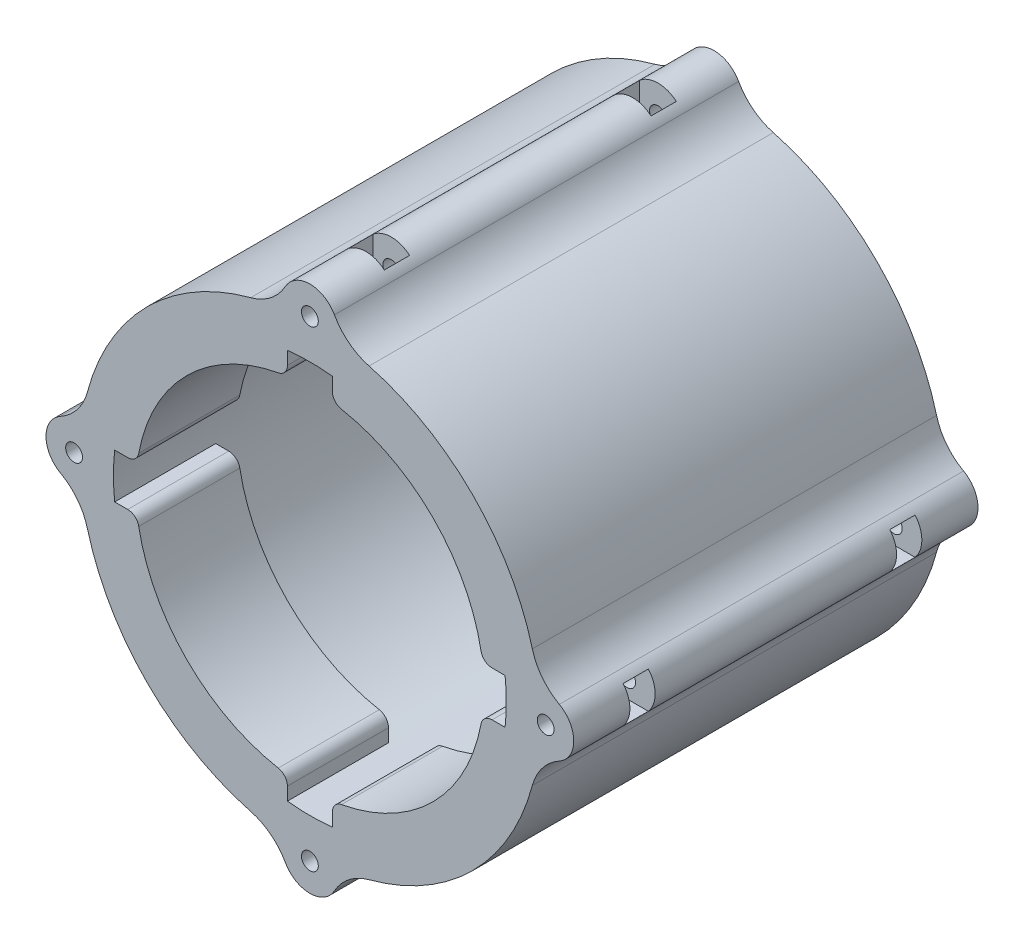
from build123d import *

# Parameters (mm, degrees)
IZIM1_R                     = 35
IZIM1_R_2                   = 1.5
Y_KSEKLIK_EKSTR_ZYON1_DEPTH = 72
Y_KSEKLIK_EKSTR_ZYON2_START = -18
Y_KSEKLIK_EKSTR_ZYON2_DEPTH = 18
KES_EKSTR_ZYON1_DEPTH       = 4.5
DAIRESEL_KAPLAMA1_COUNT     = 4
AYNALAMA1_COPY_1_DEPTH      = 4.5
AYNALAMA1_COPY_2_DEPTH      = 4.5
AYNALAMA1_COPY_3_DEPTH      = 4.5
AYNALAMA1_COPY_4_DEPTH      = 4.5


with BuildPart() as part:
    # Çizim1 → Yükseklik-Ekstrüzyon1 (new body)
    with BuildSketch(Plane.XY):
        with BuildLine():
            ThreePointArc((-39.621848739, -10.540830255), (-28.991378029, -28.991378029), (-10.540830255, -39.621848739))
            ThreePointArc((-10.540830255, -39.621848739), (-6.966269622, -41.396931543), (-4.370588155, -44.428571429))
            ThreePointArc((-4.370588155, -44.428571429), (0, -47), (4.370588155, -44.428571429))
            ThreePointArc((4.370588155, -44.428571429), (6.966269622, -41.396931543), (10.540830255, -39.621848739))
            ThreePointArc((10.540830255, -39.621848739), (28.991378029, -28.991378029), (39.621848739, -10.540830255))
            ThreePointArc((39.621848739, -10.540830255), (41.396931543, -6.966269622), (44.428571429, -4.370588155))
            ThreePointArc((44.428571429, -4.370588155), (47, 0), (44.428571429, 4.370588155))
            ThreePointArc((44.428571429, 4.370588155), (41.396931543, 6.966269622), (39.621848739, 10.540830255))
            ThreePointArc((39.621848739, 10.540830255), (28.991378029, 28.991378029), (10.540830255, 39.621848739))
            ThreePointArc((10.540830255, 39.621848739), (6.966269622, 41.396931543), (4.370588155, 44.428571429))
            ThreePointArc((4.370588155, 44.428571429), (0, 47), (-4.370588155, 44.428571429))
            ThreePointArc((-4.370588155, 44.428571429), (-6.966269622, 41.396931543), (-10.540830255, 39.621848739))
            ThreePointArc((-10.540830255, 39.621848739), (-28.991378029, 28.991378029), (-39.621848739, 10.540830255))
            ThreePointArc((-39.621848739, 10.540830255), (-41.396931543, 6.966269622), (-44.428571429, 4.370588155))
            ThreePointArc((-44.428571429, 4.370588155), (-47, 0), (-44.428571429, -4.370588155))
            ThreePointArc((-44.428571429, -4.370588155), (-41.396931543, -6.966269622), (-39.621848739, -10.540830255))
        make_face()
        Circle(IZIM1_R, mode=Mode.SUBTRACT)
        with Locations((-42, 0)):
            Circle(IZIM1_R_2, mode=Mode.SUBTRACT)
        with Locations((0, 42)):
            Circle(IZIM1_R_2, mode=Mode.SUBTRACT)
        with Locations((42, 0)):
            Circle(IZIM1_R_2, mode=Mode.SUBTRACT)
        with Locations((0, -42)):
            Circle(IZIM1_R_2, mode=Mode.SUBTRACT)
    extrude(amount=Y_KSEKLIK_EKSTR_ZYON1_DEPTH)

    # Çizim2 → Yükseklik-Ekstrüzyon2 (add)
    with BuildSketch(Plane.XY.offset(72).offset(Y_KSEKLIK_EKSTR_ZYON2_START)):
        with BuildLine():
            Line((-4, 34.770677301), (-4, 32.449961479))
            ThreePointArc((-4, 32.449961479), (-4.46258777, 31.170757181), (-5.636363636, 30.483297147))
            ThreePointArc((-5.636363636, 30.483297147), (-21.920310217, 21.920310217), (-30.483297147, 5.636363636))
            ThreePointArc((-30.483297147, 5.636363636), (-31.170757181, 4.46258777), (-32.449961479, 4))
            Line((-32.449961479, 4), (-34.770677301, 4))
            ThreePointArc((-34.770677301, 4), (-24.748737342, 24.748737342), (-4, 34.770677301))
        make_face()
        with BuildLine():
            Line((4, 34.770677301), (4, 32.449961479))
            ThreePointArc((4, 32.449961479), (4.46258777, 31.170757181), (5.636363636, 30.483297147))
            ThreePointArc((5.636363636, 30.483297147), (21.920310217, 21.920310217), (30.483297147, 5.636363636))
            ThreePointArc((30.483297147, 5.636363636), (31.170757181, 4.46258777), (32.449961479, 4))
            Line((32.449961479, 4), (34.770677301, 4))
            ThreePointArc((34.770677301, 4), (24.748737342, 24.748737342), (4, 34.770677301))
        make_face()
        with BuildLine():
            Line((34.770677301, -4), (32.449961479, -4))
            ThreePointArc((32.449961479, -4), (31.170757181, -4.46258777), (30.483297147, -5.636363636))
            ThreePointArc((30.483297147, -5.636363636), (21.920310217, -21.920310217), (5.636363636, -30.483297147))
            ThreePointArc((5.636363636, -30.483297147), (4.46258777, -31.170757181), (4, -32.449961479))
            Line((4, -32.449961479), (4, -34.770677301))
            ThreePointArc((4, -34.770677301), (24.748737342, -24.748737342), (34.770677301, -4))
        make_face()
        with BuildLine():
            Line((-4, -34.770677301), (-4, -32.449961479))
            ThreePointArc((-4, -32.449961479), (-4.46258777, -31.170757181), (-5.636363636, -30.483297147))
            ThreePointArc((-5.636363636, -30.483297147), (-21.920310217, -21.920310217), (-30.483297147, -5.636363636))
            ThreePointArc((-30.483297147, -5.636363636), (-31.170757181, -4.46258777), (-32.449961479, -4))
            Line((-32.449961479, -4), (-34.770677301, -4))
            ThreePointArc((-34.770677301, -4), (-24.748737342, -24.748737342), (-4, -34.770677301))
        make_face()
    extrude(amount=Y_KSEKLIK_EKSTR_ZYON2_DEPTH)

    # Çizim3 → Kes-Ekstrüzyon1 (cut)
    with BuildSketch(Plane(origin=(0, 0, 10), x_dir=(-1, 0, 0), z_dir=(0, 0, -1))):
        Polygon((-3.262029021, -42), (-3.262029021, -48), (3.262029021, -48), (3.262029021, -42), (1.63101451, -39.175), (-1.63101451, -39.175), align=None)
    kes_ekstr_zyon1 = extrude(amount=-KES_EKSTR_ZYON1_DEPTH, mode=Mode.SUBTRACT)

    # Dairesel Kaplama1: Kes-Ekstrüzyon1 ×4 about axis
    dairesel_kaplama1_axis = Axis((0, 0, 0), (0, 0, 1))
    for i in range(1, DAIRESEL_KAPLAMA1_COUNT):
        add(kes_ekstr_zyon1.rotate(dairesel_kaplama1_axis, i * 360 / DAIRESEL_KAPLAMA1_COUNT), mode=Mode.SUBTRACT)

    # Aynalama1 copy 1 sketch → Aynalama1 copy 1 (cut)
    with BuildSketch(Plane(origin=(0, 0, 62), x_dir=(0, -1, 0), z_dir=(0, 0, 1))):
        Polygon((-3.262029021, 42), (-3.262029021, 48), (3.262029021, 48), (3.262029021, 42), (1.63101451, 39.175), (-1.63101451, 39.175), align=None)
    extrude(amount=-AYNALAMA1_COPY_1_DEPTH, mode=Mode.SUBTRACT)

    # Aynalama1 copy 2 sketch → Aynalama1 copy 2 (cut)
    with BuildSketch(Plane.XY.offset(62)):
        Polygon((-3.262029021, 42), (-3.262029021, 48), (3.262029021, 48), (3.262029021, 42), (1.63101451, 39.175), (-1.63101451, 39.175), align=None)
    extrude(amount=-AYNALAMA1_COPY_2_DEPTH, mode=Mode.SUBTRACT)

    # Aynalama1 copy 3 sketch → Aynalama1 copy 3 (cut)
    with BuildSketch(Plane(origin=(0, 0, 62), x_dir=(0, 1, 0), z_dir=(0, 0, 1))):
        Polygon((-3.262029021, 42), (-3.262029021, 48), (3.262029021, 48), (3.262029021, 42), (1.63101451, 39.175), (-1.63101451, 39.175), align=None)
    extrude(amount=-AYNALAMA1_COPY_3_DEPTH, mode=Mode.SUBTRACT)

    # Aynalama1 copy 4 sketch → Aynalama1 copy 4 (cut)
    with BuildSketch(Plane(origin=(0, 0, 62), x_dir=(-1, 0, 0), z_dir=(0, 0, 1))):
        Polygon((-3.262029021, 42), (-3.262029021, 48), (3.262029021, 48), (3.262029021, 42), (1.63101451, 39.175), (-1.63101451, 39.175), align=None)
    extrude(amount=-AYNALAMA1_COPY_4_DEPTH, mode=Mode.SUBTRACT)


solid = part.part
